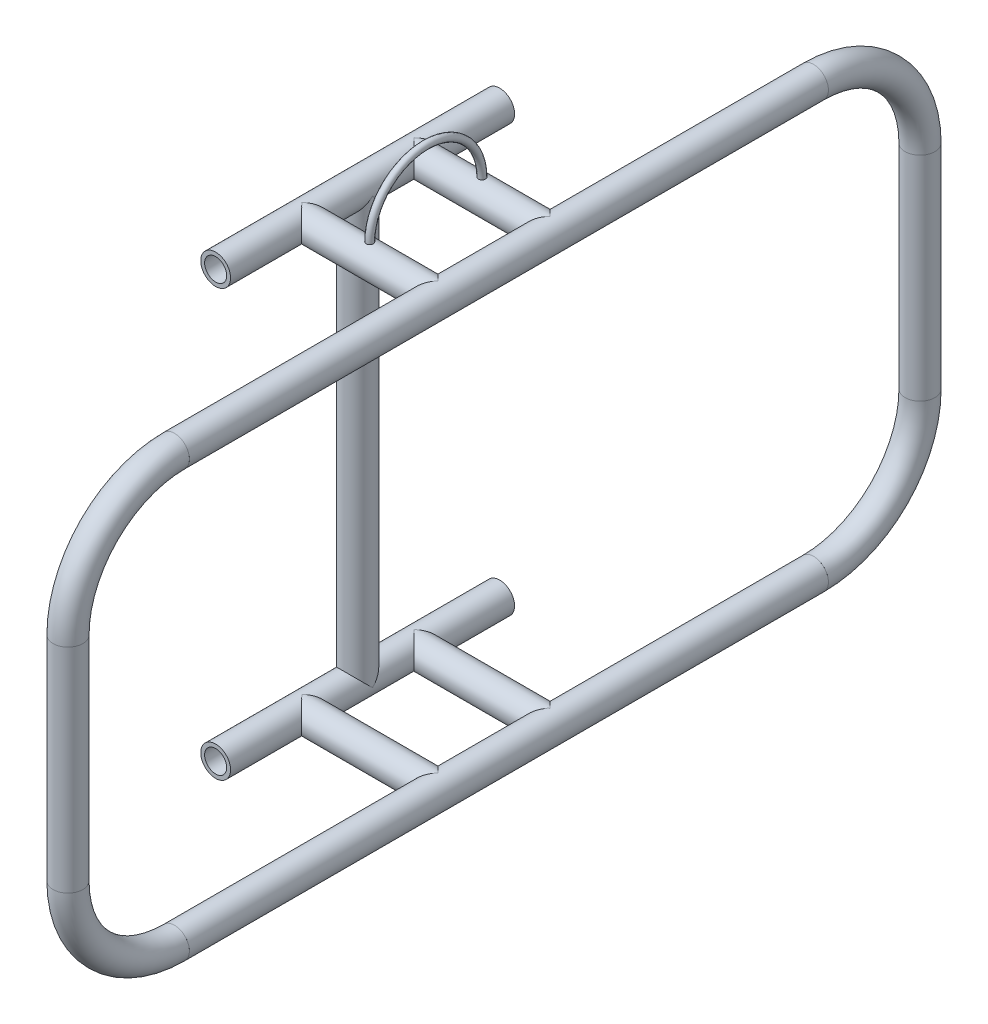
from build123d import *

# Parameters (mm, degrees)
PIPE_START                                 = -230.215178867
PIPE_CONFIGURED_0_5_SCH_40_1_OUTLINE_R     = 10.668
PIPE_CONFIGURED_0_5_SCH_40_1_OUTLINE_R_2   = 7.8994
PIPE_CONFIGURED_0_5_SCH_40_1_DEPTH         = 457.2
PIPE_CONFIGURED_0_5_SCH_40_1_2_OUTLINE_R   = 10.668
PIPE_CONFIGURED_0_5_SCH_40_1_2_OUTLINE_R_2 = 7.8994
PIPE_CONFIGURED_0_5_SCH_40_1_2_ANGLE       = 90
PIPE_CONFIGURED_0_5_SCH_40_1_3_OUTLINE_R   = 10.668
PIPE_CONFIGURED_0_5_SCH_40_1_3_OUTLINE_R_2 = 7.8994
PIPE_CONFIGURED_0_5_SCH_40_1_3_ANGLE       = 90
PIPE_START_2                               = -75.951662786
PIPE_CONFIGURED_0_5_SCH_40_1_4_OUTLINE_R   = 10.668
PIPE_CONFIGURED_0_5_SCH_40_1_4_OUTLINE_R_2 = 7.8994
PIPE_CONFIGURED_0_5_SCH_40_1_4_DEPTH       = 152.4
PIPE_CONFIGURED_0_5_SCH_40_1_5_OUTLINE_R   = 10.668
PIPE_CONFIGURED_0_5_SCH_40_1_5_OUTLINE_R_2 = 7.8994
PIPE_CONFIGURED_0_5_SCH_40_1_5_ANGLE       = 90
PIPE_CONFIGURED_0_5_SCH_40_1_6_OUTLINE_R   = 10.668
PIPE_CONFIGURED_0_5_SCH_40_1_6_OUTLINE_R_2 = 7.8994
PIPE_CONFIGURED_0_5_SCH_40_1_6_DEPTH       = 457.2
PIPE_CONFIGURED_0_5_SCH_40_1_7_OUTLINE_R   = 10.668
PIPE_CONFIGURED_0_5_SCH_40_1_7_OUTLINE_R_2 = 7.8994
PIPE_CONFIGURED_0_5_SCH_40_1_7_ANGLE       = 90
PIPE_CONFIGURED_0_5_SCH_40_1_8_OUTLINE_R   = 10.668
PIPE_CONFIGURED_0_5_SCH_40_1_8_OUTLINE_R_2 = 7.8994
PIPE_CONFIGURED_0_5_SCH_40_1_8_DEPTH       = 152.4
PIPE_START_3                               = -85.489574031
PIPE_CONFIGURED_0_5_SCH_40_1_9_OUTLINE_R   = 10.668
PIPE_CONFIGURED_0_5_SCH_40_1_9_OUTLINE_R_2 = 7.8994
PIPE_CONFIGURED_0_5_SCH_40_1_9_DEPTH       = 97.5360002
PIPE_CONFIGURED_0_5_SCH_40_1_12_OUTLIN_R   = 10.668
PIPE_CONFIGURED_0_5_SCH_40_1_12_OUTLIN_R_2 = 7.8994
PIPE_CONFIGURED_0_5_SCH_40_1_12_DEPTH      = 97.5360002
PIPE_CONFIGURED_0_5_SCH_40_1_15_OUTLIN_R   = 10.668
PIPE_CONFIGURED_0_5_SCH_40_1_15_OUTLIN_R_2 = 7.8994
PIPE_CONFIGURED_0_5_SCH_40_1_15_DEPTH      = 97.5360002
PIPE_CONFIGURED_0_5_SCH_40_1_18_OUTLIN_R   = 10.668
PIPE_CONFIGURED_0_5_SCH_40_1_18_OUTLIN_R_2 = 7.8994
PIPE_CONFIGURED_0_5_SCH_40_1_18_DEPTH      = 97.5360002
PIPE_START_4                               = -152.151662886
PIPE_CONFIGURED_0_5_SCH_40_1_21_OUTLIN_R   = 10.668
PIPE_CONFIGURED_0_5_SCH_40_1_21_OUTLIN_R_2 = 7.8994
PIPE_CONFIGURED_0_5_SCH_40_1_21_DEPTH      = 304.8000002
PIPE_START_5                               = -103.215178867
PIPE_CONFIGURED_0_5_SCH_40_1_24_OUTLIN_R   = 10.668
PIPE_CONFIGURED_0_5_SCH_40_1_24_OUTLIN_R_2 = 7.8994
PIPE_CONFIGURED_0_5_SCH_40_1_24_DEPTH      = 203.2
PIPE_CONFIGURED_0_5_SCH_40_1_25_OUTLIN_R   = 10.668
PIPE_CONFIGURED_0_5_SCH_40_1_25_OUTLIN_R_2 = 7.8994
PIPE_CONFIGURED_0_5_SCH_40_1_25_DEPTH      = 203.2
SKETCH13_R                                 = 2.54


with BuildPart() as part:
    # Pipe - configured 0.5 SCH 40(1): read off the stored shape, not the designer's step
    # Pipe - configured 0.5 SCH 40(1) outline → Pipe - configured 0.5 SCH 40(1) (new body)
    with BuildSketch(Plane.XY.offset(PIPE_START)):
        with Locations((12.046426069, 152.648337214)):
            Circle(PIPE_CONFIGURED_0_5_SCH_40_1_OUTLINE_R)
        with Locations((12.046426069, 152.648337214)):
            Circle(PIPE_CONFIGURED_0_5_SCH_40_1_OUTLINE_R_2, mode=Mode.SUBTRACT)
    extrude(amount=PIPE_CONFIGURED_0_5_SCH_40_1_DEPTH)


with BuildPart() as body_2:
    # Pipe - configured 0.5 SCH 40_1 2 outline → Pipe - configured 0.5 SCH 40_1 2 (revolve)
    with BuildSketch(Plane(origin=(0, 76.448337214, 226.984821133), x_dir=(0, 1, 0), z_dir=(0, 0, -1))):
        with Locations((76.2, 12.046426069)):
            Circle(PIPE_CONFIGURED_0_5_SCH_40_1_2_OUTLINE_R)
        with Locations((76.2, 12.046426069)):
            Circle(PIPE_CONFIGURED_0_5_SCH_40_1_2_OUTLINE_R_2, mode=Mode.SUBTRACT)
    revolve(axis=Axis((0, 76.448337214, 226.984821133), (1, 0, 0)), revolution_arc=PIPE_CONFIGURED_0_5_SCH_40_1_2_ANGLE)


with BuildPart() as body_3:
    # Pipe - configured 0.5 SCH 40_1 3 outline → Pipe - configured 0.5 SCH 40_1 3 (revolve)
    with BuildSketch(Plane(origin=(0, 76.448337214, -230.215178867), x_dir=(0, 0, -1), z_dir=(0, -1, 0))):
        with Locations((76.2, 12.046426069)):
            Circle(PIPE_CONFIGURED_0_5_SCH_40_1_3_OUTLINE_R)
        with Locations((76.2, 12.046426069)):
            Circle(PIPE_CONFIGURED_0_5_SCH_40_1_3_OUTLINE_R_2, mode=Mode.SUBTRACT)
    revolve(axis=Axis((0, 76.448337214, -230.215178867), (1, 0, 0)), revolution_arc=PIPE_CONFIGURED_0_5_SCH_40_1_3_ANGLE)


with BuildPart() as body_4:
    # Pipe - configured 0.5 SCH 40_1 4 outline → Pipe - configured 0.5 SCH 40_1 4 (new body)
    with BuildSketch(Plane(origin=(0, 0, 0), x_dir=(1, 0, 0), z_dir=(0, 1, 0)).offset(PIPE_START_2)):
        with Locations((12.046426069, 306.415178867)):
            Circle(PIPE_CONFIGURED_0_5_SCH_40_1_4_OUTLINE_R)
        with Locations((12.046426069, 306.415178867)):
            Circle(PIPE_CONFIGURED_0_5_SCH_40_1_4_OUTLINE_R_2, mode=Mode.SUBTRACT)
    extrude(amount=PIPE_CONFIGURED_0_5_SCH_40_1_4_DEPTH)


with BuildPart() as body_5:
    # Pipe - configured 0.5 SCH 40_1 5 outline → Pipe - configured 0.5 SCH 40_1 5 (revolve)
    with BuildSketch(Plane(origin=(0, -75.951662786, -230.215178867), x_dir=(0, -1, 0), z_dir=(0, 0, 1))):
        with Locations((76.2, 12.046426069)):
            Circle(PIPE_CONFIGURED_0_5_SCH_40_1_5_OUTLINE_R)
        with Locations((76.2, 12.046426069)):
            Circle(PIPE_CONFIGURED_0_5_SCH_40_1_5_OUTLINE_R_2, mode=Mode.SUBTRACT)
    revolve(axis=Axis((0, -75.951662786, -230.215178867), (1, 0, 0)), revolution_arc=PIPE_CONFIGURED_0_5_SCH_40_1_5_ANGLE)


with BuildPart() as body_6:
    # Pipe - configured 0.5 SCH 40_1 6 outline → Pipe - configured 0.5 SCH 40_1 6 (new body)
    with BuildSketch(Plane.XY.offset(PIPE_START)):
        with Locations((12.046426069, -152.151662786)):
            Circle(PIPE_CONFIGURED_0_5_SCH_40_1_6_OUTLINE_R)
        with Locations((12.046426069, -152.151662786)):
            Circle(PIPE_CONFIGURED_0_5_SCH_40_1_6_OUTLINE_R_2, mode=Mode.SUBTRACT)
    extrude(amount=PIPE_CONFIGURED_0_5_SCH_40_1_6_DEPTH)


with BuildPart() as body_7:
    # Pipe - configured 0.5 SCH 40_1 7 outline → Pipe - configured 0.5 SCH 40_1 7 (revolve)
    with BuildSketch(Plane(origin=(0, -75.951662786, 226.984821133), x_dir=(0, 0, 1), z_dir=(0, 1, 0))):
        with Locations((76.2, 12.046426069)):
            Circle(PIPE_CONFIGURED_0_5_SCH_40_1_7_OUTLINE_R)
        with Locations((76.2, 12.046426069)):
            Circle(PIPE_CONFIGURED_0_5_SCH_40_1_7_OUTLINE_R_2, mode=Mode.SUBTRACT)
    revolve(axis=Axis((0, -75.951662786, 226.984821133), (1, 0, 0)), revolution_arc=PIPE_CONFIGURED_0_5_SCH_40_1_7_ANGLE)


with BuildPart() as body_8:
    # Pipe - configured 0.5 SCH 40_1 8 outline → Pipe - configured 0.5 SCH 40_1 8 (new body)
    with BuildSketch(Plane(origin=(0, 0, 0), x_dir=(1, 0, 0), z_dir=(0, 1, 0)).offset(PIPE_START_2)):
        with Locations((12.046426069, -303.184821133)):
            Circle(PIPE_CONFIGURED_0_5_SCH_40_1_8_OUTLINE_R)
        with Locations((12.046426069, -303.184821133)):
            Circle(PIPE_CONFIGURED_0_5_SCH_40_1_8_OUTLINE_R_2, mode=Mode.SUBTRACT)
    extrude(amount=PIPE_CONFIGURED_0_5_SCH_40_1_8_DEPTH)


with BuildPart() as body_9:
    # Pipe - configured 0.5 SCH 40_1 9 outline → Pipe - configured 0.5 SCH 40_1 9 (new body)
    with BuildSketch(Plane.YZ.offset(PIPE_START_3)):
        with Locations((152.648337214, -41.747178867)):
            Circle(PIPE_CONFIGURED_0_5_SCH_40_1_9_OUTLINE_R)
        with Locations((152.648337214, -41.747178867)):
            Circle(PIPE_CONFIGURED_0_5_SCH_40_1_9_OUTLINE_R_2, mode=Mode.SUBTRACT)
    extrude(amount=PIPE_CONFIGURED_0_5_SCH_40_1_9_DEPTH)

    # Pipe - configured 0.5 SCH 40_1 10: loft between two sections, ruled curve by curve
    pipe_configured_0_5_sch_40_1_10_from = [
        Edge.make_three_point_arc((12.046426069, 163.316337214, -52.451497042), (4.503010928, 160.191752355, -52.451497042), (1.378426069, 152.648337214, -52.451497042)),
        Edge.make_three_point_arc((1.378426069, 152.648337214, -52.451497042), (4.503010928, 145.104922072, -52.451497042), (12.046426069, 141.980337214, -52.451497042)),
        Edge.make_line((12.046426069, 141.980337214, -52.451497042), (12.046426069, 163.316337214, -52.451497042)),
    ]
    pipe_configured_0_5_sch_40_1_10_to = [
        Edge.make_three_point_arc((12.046426069, 163.316337214, -31.042860692), (4.503010928, 160.191752355, -31.042860692), (1.378426069, 152.648337214, -31.042860692)),
        Edge.make_three_point_arc((1.378426069, 152.648337214, -31.042860692), (4.503010928, 145.104922072, -31.042860692), (12.046426069, 141.980337214, -31.042860692)),
        Edge.make_line((12.046426069, 141.980337214, -31.042860692), (12.046426069, 163.316337214, -31.042860692)),
    ]
    pipe_configured_0_5_sch_40_1_10 = Solid(Shell([*[Face.make_surface_from_curves(pipe_configured_0_5_sch_40_1_10_from[k], pipe_configured_0_5_sch_40_1_10_to[k]) for k in range(3)], Face(Wire(pipe_configured_0_5_sch_40_1_10_from)), Face(Wire(pipe_configured_0_5_sch_40_1_10_to))]))
    add(pipe_configured_0_5_sch_40_1_10, mode=Mode.SUBTRACT)

    # Pipe - configured 0.5 SCH 40_1 11: loft between two sections, ruled curve by curve
    pipe_configured_0_5_sch_40_1_11_from = [
        Edge.make_three_point_arc((-85.489573931, 163.316337214, -31.042860692), (-77.946158789, 160.191752355, -31.042860692), (-74.821573931, 152.648337214, -31.042860692)),
        Edge.make_three_point_arc((-74.821573931, 152.648337214, -31.042860692), (-77.946158789, 145.104922072, -31.042860692), (-85.489573931, 141.980337214, -31.042860692)),
        Edge.make_line((-85.489573931, 141.980337214, -31.042860692), (-85.489573931, 163.316337214, -31.042860692)),
    ]
    pipe_configured_0_5_sch_40_1_11_to = [
        Edge.make_three_point_arc((-85.489573931, 163.316337214, -52.451497042), (-77.946158789, 160.191752355, -52.451497042), (-74.821573931, 152.648337214, -52.451497042)),
        Edge.make_three_point_arc((-74.821573931, 152.648337214, -52.451497042), (-77.946158789, 145.104922072, -52.451497042), (-85.489573931, 141.980337214, -52.451497042)),
        Edge.make_line((-85.489573931, 141.980337214, -52.451497042), (-85.489573931, 163.316337214, -52.451497042)),
    ]
    pipe_configured_0_5_sch_40_1_11 = Solid(Shell([*[Face.make_surface_from_curves(pipe_configured_0_5_sch_40_1_11_from[k], pipe_configured_0_5_sch_40_1_11_to[k]) for k in range(3)], Face(Wire(pipe_configured_0_5_sch_40_1_11_from)), Face(Wire(pipe_configured_0_5_sch_40_1_11_to))]))
    add(pipe_configured_0_5_sch_40_1_11, mode=Mode.SUBTRACT)


with BuildPart() as body_10:
    # Pipe - configured 0.5 SCH 40_1 12 outlin → Pipe - configured 0.5 SCH 40_1 12 (new body)
    with BuildSketch(Plane.YZ.offset(PIPE_START_3)):
        with Locations((-152.151662786, -41.747178867)):
            Circle(PIPE_CONFIGURED_0_5_SCH_40_1_12_OUTLIN_R)
        with Locations((-152.151662786, -41.747178867)):
            Circle(PIPE_CONFIGURED_0_5_SCH_40_1_12_OUTLIN_R_2, mode=Mode.SUBTRACT)
    extrude(amount=PIPE_CONFIGURED_0_5_SCH_40_1_12_DEPTH)

    # Pipe - configured 0.5 SCH 40_1 13: loft between two sections, ruled curve by curve
    pipe_configured_0_5_sch_40_1_13_from = [
        Edge.make_three_point_arc((12.046426069, -162.819662786, -31.042860692), (4.503010928, -159.695077928, -31.042860692), (1.378426069, -152.151662786, -31.042860692)),
        Edge.make_three_point_arc((1.378426069, -152.151662786, -31.042860692), (4.503010928, -144.608247645, -31.042860692), (12.046426069, -141.483662786, -31.042860692)),
        Edge.make_line((12.046426069, -141.483662786, -31.042860692), (12.046426069, -162.819662786, -31.042860692)),
    ]
    pipe_configured_0_5_sch_40_1_13_to = [
        Edge.make_three_point_arc((12.046426069, -162.819662786, -52.451497042), (4.503010928, -159.695077928, -52.451497042), (1.378426069, -152.151662786, -52.451497042)),
        Edge.make_three_point_arc((1.378426069, -152.151662786, -52.451497042), (4.503010928, -144.608247645, -52.451497042), (12.046426069, -141.483662786, -52.451497042)),
        Edge.make_line((12.046426069, -141.483662786, -52.451497042), (12.046426069, -162.819662786, -52.451497042)),
    ]
    pipe_configured_0_5_sch_40_1_13 = Solid(Shell([*[Face.make_surface_from_curves(pipe_configured_0_5_sch_40_1_13_from[k], pipe_configured_0_5_sch_40_1_13_to[k]) for k in range(3)], Face(Wire(pipe_configured_0_5_sch_40_1_13_from)), Face(Wire(pipe_configured_0_5_sch_40_1_13_to))]))
    add(pipe_configured_0_5_sch_40_1_13, mode=Mode.SUBTRACT)

    # Pipe - configured 0.5 SCH 40_1 14: loft between two sections, ruled curve by curve
    pipe_configured_0_5_sch_40_1_14_from = [
        Edge.make_three_point_arc((-85.489573931, -141.483662786, -31.042860692), (-77.946158789, -144.608247645, -31.042860692), (-74.821573931, -152.151662786, -31.042860692)),
        Edge.make_three_point_arc((-74.821573931, -152.151662786, -31.042860692), (-77.946158789, -159.695077928, -31.042860692), (-85.489573931, -162.819662786, -31.042860692)),
        Edge.make_line((-85.489573931, -162.819662786, -31.042860692), (-85.489573931, -141.483662786, -31.042860692)),
    ]
    pipe_configured_0_5_sch_40_1_14_to = [
        Edge.make_three_point_arc((-85.489573931, -141.483662786, -52.451497042), (-77.946158789, -144.608247645, -52.451497042), (-74.821573931, -152.151662786, -52.451497042)),
        Edge.make_three_point_arc((-74.821573931, -152.151662786, -52.451497042), (-77.946158789, -159.695077928, -52.451497042), (-85.489573931, -162.819662786, -52.451497042)),
        Edge.make_line((-85.489573931, -162.819662786, -52.451497042), (-85.489573931, -141.483662786, -52.451497042)),
    ]
    pipe_configured_0_5_sch_40_1_14 = Solid(Shell([*[Face.make_surface_from_curves(pipe_configured_0_5_sch_40_1_14_from[k], pipe_configured_0_5_sch_40_1_14_to[k]) for k in range(3)], Face(Wire(pipe_configured_0_5_sch_40_1_14_from)), Face(Wire(pipe_configured_0_5_sch_40_1_14_to))]))
    add(pipe_configured_0_5_sch_40_1_14, mode=Mode.SUBTRACT)


with BuildPart() as body_11:
    # Pipe - configured 0.5 SCH 40_1 15 outlin → Pipe - configured 0.5 SCH 40_1 15 (new body)
    with BuildSketch(Plane.YZ.offset(PIPE_START_3)):
        with Locations((152.648337214, 38.516821133)):
            Circle(PIPE_CONFIGURED_0_5_SCH_40_1_15_OUTLIN_R)
        with Locations((152.648337214, 38.516821133)):
            Circle(PIPE_CONFIGURED_0_5_SCH_40_1_15_OUTLIN_R_2, mode=Mode.SUBTRACT)
    extrude(amount=PIPE_CONFIGURED_0_5_SCH_40_1_15_DEPTH)

    # Pipe - configured 0.5 SCH 40_1 16: loft between two sections, ruled curve by curve
    pipe_configured_0_5_sch_40_1_16_from = [
        Edge.make_three_point_arc((-85.489573931, 163.316337214, 49.221139308), (-77.946158789, 160.191752355, 49.221139308), (-74.821573931, 152.648337214, 49.221139308)),
        Edge.make_three_point_arc((-74.821573931, 152.648337214, 49.221139308), (-77.946158789, 145.104922072, 49.221139308), (-85.489573931, 141.980337214, 49.221139308)),
        Edge.make_line((-85.489573931, 141.980337214, 49.221139308), (-85.489573931, 163.316337214, 49.221139308)),
    ]
    pipe_configured_0_5_sch_40_1_16_to = [
        Edge.make_three_point_arc((-85.489573931, 163.316337214, 27.812502958), (-77.946158789, 160.191752355, 27.812502958), (-74.821573931, 152.648337214, 27.812502958)),
        Edge.make_three_point_arc((-74.821573931, 152.648337214, 27.812502958), (-77.946158789, 145.104922072, 27.812502958), (-85.489573931, 141.980337214, 27.812502958)),
        Edge.make_line((-85.489573931, 141.980337214, 27.812502958), (-85.489573931, 163.316337214, 27.812502958)),
    ]
    pipe_configured_0_5_sch_40_1_16 = Solid(Shell([*[Face.make_surface_from_curves(pipe_configured_0_5_sch_40_1_16_from[k], pipe_configured_0_5_sch_40_1_16_to[k]) for k in range(3)], Face(Wire(pipe_configured_0_5_sch_40_1_16_from)), Face(Wire(pipe_configured_0_5_sch_40_1_16_to))]))
    add(pipe_configured_0_5_sch_40_1_16, mode=Mode.SUBTRACT)

    # Pipe - configured 0.5 SCH 40_1 17: loft between two sections, ruled curve by curve
    pipe_configured_0_5_sch_40_1_17_from = [
        Edge.make_three_point_arc((12.046426069, 163.316337214, 27.812502958), (4.503010928, 160.191752355, 27.812502958), (1.378426069, 152.648337214, 27.812502958)),
        Edge.make_three_point_arc((1.378426069, 152.648337214, 27.812502958), (4.503010928, 145.104922072, 27.812502958), (12.046426069, 141.980337214, 27.812502958)),
        Edge.make_line((12.046426069, 141.980337214, 27.812502958), (12.046426069, 163.316337214, 27.812502958)),
    ]
    pipe_configured_0_5_sch_40_1_17_to = [
        Edge.make_three_point_arc((12.046426069, 163.316337214, 49.221139308), (4.503010928, 160.191752355, 49.221139308), (1.378426069, 152.648337214, 49.221139308)),
        Edge.make_three_point_arc((1.378426069, 152.648337214, 49.221139308), (4.503010928, 145.104922072, 49.221139308), (12.046426069, 141.980337214, 49.221139308)),
        Edge.make_line((12.046426069, 141.980337214, 49.221139308), (12.046426069, 163.316337214, 49.221139308)),
    ]
    pipe_configured_0_5_sch_40_1_17 = Solid(Shell([*[Face.make_surface_from_curves(pipe_configured_0_5_sch_40_1_17_from[k], pipe_configured_0_5_sch_40_1_17_to[k]) for k in range(3)], Face(Wire(pipe_configured_0_5_sch_40_1_17_from)), Face(Wire(pipe_configured_0_5_sch_40_1_17_to))]))
    add(pipe_configured_0_5_sch_40_1_17, mode=Mode.SUBTRACT)


with BuildPart() as body_12:
    # Pipe - configured 0.5 SCH 40_1 18 outlin → Pipe - configured 0.5 SCH 40_1 18 (new body)
    with BuildSketch(Plane.YZ.offset(PIPE_START_3)):
        with Locations((-152.151662786, 38.516821133)):
            Circle(PIPE_CONFIGURED_0_5_SCH_40_1_18_OUTLIN_R)
        with Locations((-152.151662786, 38.516821133)):
            Circle(PIPE_CONFIGURED_0_5_SCH_40_1_18_OUTLIN_R_2, mode=Mode.SUBTRACT)
    extrude(amount=PIPE_CONFIGURED_0_5_SCH_40_1_18_DEPTH)

    # Pipe - configured 0.5 SCH 40_1 19: loft between two sections, ruled curve by curve
    pipe_configured_0_5_sch_40_1_19_from = [
        Edge.make_three_point_arc((-85.489573931, -141.483662786, 49.221139308), (-77.946158789, -144.608247645, 49.221139308), (-74.821573931, -152.151662786, 49.221139308)),
        Edge.make_three_point_arc((-74.821573931, -152.151662786, 49.221139308), (-77.946158789, -159.695077928, 49.221139308), (-85.489573931, -162.819662786, 49.221139308)),
        Edge.make_line((-85.489573931, -162.819662786, 49.221139308), (-85.489573931, -141.483662786, 49.221139308)),
    ]
    pipe_configured_0_5_sch_40_1_19_to = [
        Edge.make_three_point_arc((-85.489573931, -141.483662786, 27.812502958), (-77.946158789, -144.608247645, 27.812502958), (-74.821573931, -152.151662786, 27.812502958)),
        Edge.make_three_point_arc((-74.821573931, -152.151662786, 27.812502958), (-77.946158789, -159.695077928, 27.812502958), (-85.489573931, -162.819662786, 27.812502958)),
        Edge.make_line((-85.489573931, -162.819662786, 27.812502958), (-85.489573931, -141.483662786, 27.812502958)),
    ]
    pipe_configured_0_5_sch_40_1_19 = Solid(Shell([*[Face.make_surface_from_curves(pipe_configured_0_5_sch_40_1_19_from[k], pipe_configured_0_5_sch_40_1_19_to[k]) for k in range(3)], Face(Wire(pipe_configured_0_5_sch_40_1_19_from)), Face(Wire(pipe_configured_0_5_sch_40_1_19_to))]))
    add(pipe_configured_0_5_sch_40_1_19, mode=Mode.SUBTRACT)

    # Pipe - configured 0.5 SCH 40_1 20: loft between two sections, ruled curve by curve
    pipe_configured_0_5_sch_40_1_20_from = [
        Edge.make_three_point_arc((12.046426069, -162.819662786, 49.221139308), (4.503010928, -159.695077928, 49.221139308), (1.378426069, -152.151662786, 49.221139308)),
        Edge.make_three_point_arc((1.378426069, -152.151662786, 49.221139308), (4.503010928, -144.608247645, 49.221139308), (12.046426069, -141.483662786, 49.221139308)),
        Edge.make_line((12.046426069, -141.483662786, 49.221139308), (12.046426069, -162.819662786, 49.221139308)),
    ]
    pipe_configured_0_5_sch_40_1_20_to = [
        Edge.make_three_point_arc((12.046426069, -162.819662786, 27.812502958), (4.503010928, -159.695077928, 27.812502958), (1.378426069, -152.151662786, 27.812502958)),
        Edge.make_three_point_arc((1.378426069, -152.151662786, 27.812502958), (4.503010928, -144.608247645, 27.812502958), (12.046426069, -141.483662786, 27.812502958)),
        Edge.make_line((12.046426069, -141.483662786, 27.812502958), (12.046426069, -162.819662786, 27.812502958)),
    ]
    pipe_configured_0_5_sch_40_1_20 = Solid(Shell([*[Face.make_surface_from_curves(pipe_configured_0_5_sch_40_1_20_from[k], pipe_configured_0_5_sch_40_1_20_to[k]) for k in range(3)], Face(Wire(pipe_configured_0_5_sch_40_1_20_from)), Face(Wire(pipe_configured_0_5_sch_40_1_20_to))]))
    add(pipe_configured_0_5_sch_40_1_20, mode=Mode.SUBTRACT)


with BuildPart() as body_13:
    # Pipe - configured 0.5 SCH 40_1 21 outlin → Pipe - configured 0.5 SCH 40_1 21 (new body)
    with BuildSketch(Plane(origin=(0, 0, 0), x_dir=(1, 0, 0), z_dir=(0, 1, 0)).offset(PIPE_START_4)):
        with Locations((-85.489573931, 1.615178867)):
            Circle(PIPE_CONFIGURED_0_5_SCH_40_1_21_OUTLIN_R)
        with Locations((-85.489573931, 1.615178867)):
            Circle(PIPE_CONFIGURED_0_5_SCH_40_1_21_OUTLIN_R_2, mode=Mode.SUBTRACT)
    extrude(amount=PIPE_CONFIGURED_0_5_SCH_40_1_21_DEPTH)

    # Pipe - configured 0.5 SCH 40_1 22: loft between two sections, ruled curve by curve
    pipe_configured_0_5_sch_40_1_22_from = [
        Edge.make_three_point_arc((-96.157573931, -152.151662786, 9.089139308), (-93.032989072, -144.608247645, 9.089139308), (-85.489573931, -141.483662786, 9.089139308)),
        Edge.make_three_point_arc((-85.489573931, -141.483662786, 9.089139308), (-77.946158789, -144.608247645, 9.089139308), (-74.821573931, -152.151662786, 9.089139308)),
        Edge.make_line((-74.821573931, -152.151662786, 9.089139308), (-96.157573931, -152.151662786, 9.089139308)),
    ]
    pipe_configured_0_5_sch_40_1_22_to = [
        Edge.make_three_point_arc((-96.157573931, -152.151662786, -12.319497042), (-93.032989072, -144.608247645, -12.319497042), (-85.489573931, -141.483662786, -12.319497042)),
        Edge.make_three_point_arc((-85.489573931, -141.483662786, -12.319497042), (-77.946158789, -144.608247645, -12.319497042), (-74.821573931, -152.151662786, -12.319497042)),
        Edge.make_line((-74.821573931, -152.151662786, -12.319497042), (-96.157573931, -152.151662786, -12.319497042)),
    ]
    pipe_configured_0_5_sch_40_1_22 = Solid(Shell([*[Face.make_surface_from_curves(pipe_configured_0_5_sch_40_1_22_from[k], pipe_configured_0_5_sch_40_1_22_to[k]) for k in range(3)], Face(Wire(pipe_configured_0_5_sch_40_1_22_from)), Face(Wire(pipe_configured_0_5_sch_40_1_22_to))]))
    add(pipe_configured_0_5_sch_40_1_22, mode=Mode.SUBTRACT)

    # Pipe - configured 0.5 SCH 40_1 23: loft between two sections, ruled curve by curve
    pipe_configured_0_5_sch_40_1_23_from = [
        Edge.make_three_point_arc((-74.821573931, 152.648337214, 9.089139308), (-77.946158789, 145.104922072, 9.089139308), (-85.489573931, 141.980337214, 9.089139308)),
        Edge.make_three_point_arc((-85.489573931, 141.980337214, 9.089139308), (-93.032989072, 145.104922072, 9.089139308), (-96.157573931, 152.648337214, 9.089139308)),
        Edge.make_line((-96.157573931, 152.648337214, 9.089139308), (-74.821573931, 152.648337214, 9.089139308)),
    ]
    pipe_configured_0_5_sch_40_1_23_to = [
        Edge.make_three_point_arc((-74.821573931, 152.648337214, -12.319497042), (-77.946158789, 145.104922072, -12.319497042), (-85.489573931, 141.980337214, -12.319497042)),
        Edge.make_three_point_arc((-85.489573931, 141.980337214, -12.319497042), (-93.032989072, 145.104922072, -12.319497042), (-96.157573931, 152.648337214, -12.319497042)),
        Edge.make_line((-96.157573931, 152.648337214, -12.319497042), (-74.821573931, 152.648337214, -12.319497042)),
    ]
    pipe_configured_0_5_sch_40_1_23 = Solid(Shell([*[Face.make_surface_from_curves(pipe_configured_0_5_sch_40_1_23_from[k], pipe_configured_0_5_sch_40_1_23_to[k]) for k in range(3)], Face(Wire(pipe_configured_0_5_sch_40_1_23_from)), Face(Wire(pipe_configured_0_5_sch_40_1_23_to))]))
    add(pipe_configured_0_5_sch_40_1_23, mode=Mode.SUBTRACT)


with BuildPart() as body_14:
    # Pipe - configured 0.5 SCH 40_1 24 outlin → Pipe - configured 0.5 SCH 40_1 24 (new body)
    with BuildSketch(Plane.XY.offset(PIPE_START_5)):
        with Locations((-85.489573931, -152.151662786)):
            Circle(PIPE_CONFIGURED_0_5_SCH_40_1_24_OUTLIN_R)
        with Locations((-85.489573931, -152.151662786)):
            Circle(PIPE_CONFIGURED_0_5_SCH_40_1_24_OUTLIN_R_2, mode=Mode.SUBTRACT)
    extrude(amount=PIPE_CONFIGURED_0_5_SCH_40_1_24_DEPTH)


with BuildPart() as body_15:
    # Pipe - configured 0.5 SCH 40_1 25 outlin → Pipe - configured 0.5 SCH 40_1 25 (new body)
    with BuildSketch(Plane.XY.offset(PIPE_START_5)):
        with Locations((-85.489573931, 152.648337214)):
            Circle(PIPE_CONFIGURED_0_5_SCH_40_1_25_OUTLIN_R)
        with Locations((-85.489573931, 152.648337214)):
            Circle(PIPE_CONFIGURED_0_5_SCH_40_1_25_OUTLIN_R_2, mode=Mode.SUBTRACT)
    extrude(amount=PIPE_CONFIGURED_0_5_SCH_40_1_25_DEPTH)


with BuildPart() as body_16:
    # Sweep1: sweep along a path in Sketch12
    with BuildLine(Plane.ZY.offset(36.721573931)) as sweep1_path:
        ThreePointArc((38.516821133, 163.316337214), (-1.615178867, 203.448337214), (-41.747178867, 163.316337214))
    # Sketch13 → Sweep1 (sweep)
    with BuildSketch(Plane(origin=(0, 163.316337214, 0), x_dir=(1, 0, 0), z_dir=(0, 1, 0))):
        with Locations((-36.721573931, -38.516821133)):
            Circle(SKETCH13_R)
    sweep(path=sweep1_path.line)


solid = Compound([part.part, body_2.part, body_3.part, body_4.part, body_5.part, body_6.part, body_7.part, body_8.part, body_9.part, body_10.part, body_11.part, body_12.part, body_13.part, body_14.part, body_15.part, body_16.part])
